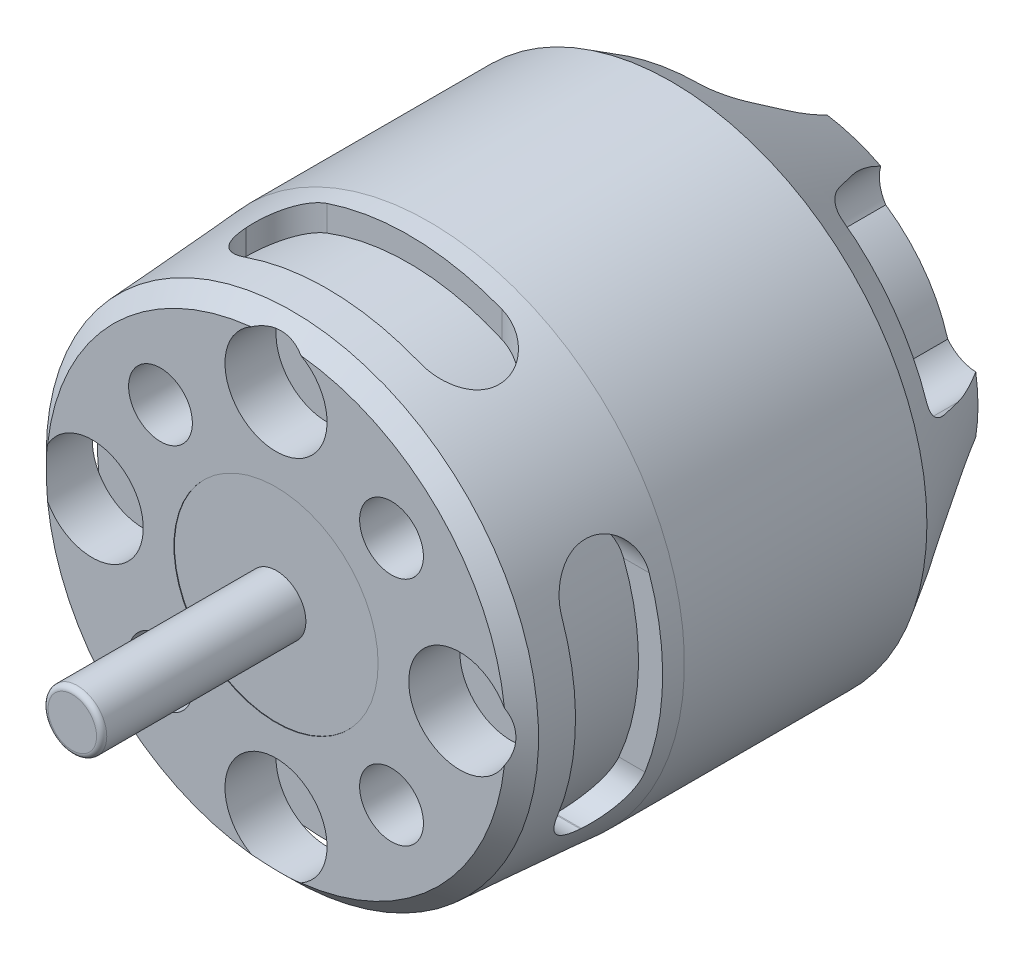
from build123d import *

# Parameters (mm, degrees)
SKETCH1_R           = 12.7
BOSS_EXTRUDE1_DEPTH = 12.065
SKETCH2_R           = 11.43
CUT_EXTRUDE1_DEPTH  = 12.065
CUT_EXTRUDE2_DEPTH  = 12.065
CUT_EXTRUDE3_DEPTH  = 35.553570476
CIRPATTERN1_COUNT   = 2
CIRPATTERN1_ANGLE   = 90
SKETCH9_R           = 1.5875
SKETCH9_R_2         = 2.54
CUT_EXTRUDE4_DEPTH  = 5.08
SKETCH9_3_R         = 5.08
CUT_EXTRUDE5_DEPTH  = 0.0254
SKETCH10_R          = 1.4605
BOSS_EXTRUDE2_DEPTH = 10.16
CHAMFER1_SIZE       = 0.818240846
CHAMFER1_SIZE_2     = 0.762
FILLET1_R           = 0.254
BOSS_EXTRUDE3_START = -26.67
SKETCH10_2_R        = 1.4605
BOSS_EXTRUDE3_DEPTH = 26.67
FILLET2_R           = 0.254
BOSS_EXTRUDE5_START = 15.24
SKETCH12_R          = 11.43
BOSS_EXTRUDE5_DEPTH = 15.24


with BuildPart() as part:
    # Sketch1 → Boss-Extrude1 (new body)
    with BuildSketch(Plane.XY):
        with Locations(Location((0, 0, 0), (0, 0, 180))):
            Circle(SKETCH1_R)
    extrude(amount=BOSS_EXTRUDE1_DEPTH)

    # Sketch2 → Cut-Extrude1 (cut)
    with BuildSketch(Plane(origin=(0, 0, 0), x_dir=(-1, 0, 0), z_dir=(0, 0, -1))):
        Circle(SKETCH2_R)
    extrude(amount=-CUT_EXTRUDE1_DEPTH, mode=Mode.SUBTRACT)

    # Sketch4 → Revolve2 (revolve)
    with BuildSketch(Plane(origin=(0, 0, 0), x_dir=(1, 0, 0), z_dir=(0, 1, 0))):
        Polygon((12.7, 0), (8.89, 6.35), (0, 6.35), (0, 0), align=None)
    revolve(axis=Axis((0, 0, 0), (0, 0, -1)))

    # Sketch5 → Cut-Extrude2 (cut)
    with BuildSketch(Plane(origin=(0, 0, -6.35), x_dir=(-1, 0, 0), z_dir=(0, 0, -1))):
        with BuildLine():
            Line((7.047210838, -7.304762618), (7.333700493, -8.186487115))
            ThreePointArc((7.333700493, -8.186487115), (7.338135843, -8.957467655), (6.895789186, -9.588942199))
            ThreePointArc((6.895789186, -9.588942199), (3.687495301, -11.220610474), (0.136739712, -11.810208434))
            ThreePointArc((0.136739712, -11.810208434), (-0.639426486, -11.583172221), (-1.121191937, -10.933648195))
            Line((-1.121191937, -10.933648195), (-1.407681592, -10.051923698))
            ThreePointArc((-1.407681592, -10.051923698), (-1.311811301, -8.635757129), (-0.263332325, -7.678986153))
            ThreePointArc((-0.263332325, -7.678986153), (2.374332076, -7.307442743), (4.726635139, -6.05764744))
            ThreePointArc((4.726635139, -6.05764744), (6.137248319, -6.215410941), (7.047210838, -7.304762618))
        make_face()
        with BuildLine():
            Line((9.12495, 4.445), (10.05205, 4.445))
            ThreePointArc((10.05205, 4.445), (10.818657769, 4.187527791), (11.274430585, 3.519507919))
            ThreePointArc((11.274430585, 3.519507919), (11.811, 0), (11.274430585, -3.519507919))
            ThreePointArc((11.274430585, -3.519507919), (10.818657769, -4.187527791), (10.05205, -4.445))
            Line((10.05205, -4.445), (9.12495, -4.445))
            ThreePointArc((9.12495, -4.445), (7.807721106, -3.916202398), (7.221775656, -2.623381144))
            ThreePointArc((7.221775656, -2.623381144), (7.6835, 0), (7.221775656, 2.623381144))
            ThreePointArc((7.221775656, 2.623381144), (7.807721106, 3.916202398), (9.12495, 4.445))
        make_face()
        with BuildLine():
            Line((-4.769534176, -8.959591578), (-5.519573832, -9.504527285))
            ThreePointArc((-5.519573832, -9.504527285), (-6.2514493, -9.746991643), (-6.988709915, -9.521431338))
            ThreePointArc((-6.988709915, -9.521431338), (-9.555299721, -6.942331615), (-11.215049451, -3.704374011))
            ThreePointArc((-11.215049451, -3.704374011), (-11.201743989, -2.933495532), (-10.744984725, -2.312366205))
            Line((-10.744984725, -2.312366205), (-9.994945069, -1.767430498))
            ThreePointArc((-9.994945069, -1.767430498), (-8.618465076, -1.420989027), (-7.384523983, -2.122493297))
            ThreePointArc((-7.384523983, -2.122493297), (-6.216082076, -4.516247986), (-4.300554487, -6.367213154))
            ThreePointArc((-4.300554487, -6.367213154), (-4.014693047, -7.757537613), (-4.769534176, -8.959591578))
        make_face()
        with BuildLine():
            Line((-9.994945069, 1.767430498), (-10.744984725, 2.312366205))
            ThreePointArc((-10.744984725, 2.312366205), (-11.201743989, 2.933495532), (-11.215049451, 3.704374011))
            ThreePointArc((-11.215049451, 3.704374011), (-9.555299721, 6.942331615), (-6.988709915, 9.521431338))
            ThreePointArc((-6.988709915, 9.521431338), (-6.2514493, 9.746991643), (-5.519573832, 9.504527285))
            Line((-5.519573832, 9.504527285), (-4.769534176, 8.959591578))
            ThreePointArc((-4.769534176, 8.959591578), (-4.014693047, 7.757537613), (-4.300554487, 6.367213154))
            ThreePointArc((-4.300554487, 6.367213154), (-6.216082076, 4.516247986), (-7.384523983, 2.122493297))
            ThreePointArc((-7.384523983, 2.122493297), (-8.618465076, 1.420989027), (-9.994945069, 1.767430498))
        make_face()
        with BuildLine():
            Line((-1.407681592, 10.051923698), (-1.121191937, 10.933648195))
            ThreePointArc((-1.121191937, 10.933648195), (-0.639426486, 11.583172221), (0.136739712, 11.810208434))
            ThreePointArc((0.136739712, 11.810208434), (3.649799721, 11.232928514), (6.831241593, 9.635032916))
            ThreePointArc((6.831241593, 9.635032916), (7.3257247, 8.995137717), (7.333700493, 8.186487115))
            Line((7.333700493, 8.186487115), (7.047210838, 7.304762618))
            ThreePointArc((7.047210838, 7.304762618), (6.137248319, 6.215410941), (4.726635139, 6.05764744))
            ThreePointArc((4.726635139, 6.05764744), (2.374332076, 7.307442743), (-0.263332325, 7.678986153))
            ThreePointArc((-0.263332325, 7.678986153), (-1.311811301, 8.635757129), (-1.407681592, 10.051923698))
        make_face()
    extrude(amount=-CUT_EXTRUDE2_DEPTH, mode=Mode.SUBTRACT)

    # Sketch6 → Revolve3 (revolve)
    with BuildSketch(Plane(origin=(0, 0, 0), x_dir=(1, 0, 0), z_dir=(0, 1, 0)), mode=Mode.PRIVATE) as revolve3_sk:
        Polygon((12.192, -19.685), (12.7, -12.065), (0, -12.065), (0, -19.685), align=None)
    revolve(revolve3_sk.sketch.rotate(Axis((0, 0, 12.065), (0, 0, 1)), 9.100389517), axis=Axis((0, 0, 12.065), (0, 0, 1)))

    # Sketch7 → Cut-Extrude3 (cut, through all)
    with BuildSketch(Plane(origin=(0, 12.7, 0), x_dir=(1, 0, 0), z_dir=(0, 1, 0))):
        with BuildLine():
            Line((4.629082018, -13.081), (-4.057717982, -13.081))
            ThreePointArc((-4.057717982, -13.081), (-5.476598449, -13.668719533), (-6.064317982, -15.0876))
            Line((-6.064317982, -15.0876), (-6.064317982, -15.1384))
            ThreePointArc((-6.064317982, -15.1384), (-5.476598449, -16.557280467), (-4.057717982, -17.145))
            Line((-4.057717982, -17.145), (4.629082018, -17.145))
            ThreePointArc((4.629082018, -17.145), (6.047962485, -16.557280467), (6.635682018, -15.1384))
            Line((6.635682018, -15.1384), (6.635682018, -15.0876))
            ThreePointArc((6.635682018, -15.0876), (6.047962485, -13.668719533), (4.629082018, -13.081))
        make_face()
    cut_extrude3 = extrude(amount=-CUT_EXTRUDE3_DEPTH, mode=Mode.SUBTRACT)

    # CirPattern1: Cut-Extrude3 ×2 about axis
    cirpattern1_axis = Axis((0, 0, 19.685), (0, 0, -1))
    for i in range(1, CIRPATTERN1_COUNT):
        add(cut_extrude3.rotate(cirpattern1_axis, i * CIRPATTERN1_ANGLE / (CIRPATTERN1_COUNT - 1)), mode=Mode.SUBTRACT)

    # Sketch9 → Cut-Extrude4 (cut)
    with BuildSketch(Plane.XY.offset(19.685)):
        with Locations((-5.747363917, -5.747363917)):
            Circle(SKETCH9_R)
        with Locations((-9.144, 0)):
            Circle(SKETCH9_R_2)
        with Locations((-5.747363917, 5.747363917)):
            Circle(SKETCH9_R)
        with Locations((0, 9.144)):
            Circle(SKETCH9_R_2)
        with Locations((5.747363917, 5.747363917)):
            Circle(SKETCH9_R)
        with Locations((9.144, 0)):
            Circle(SKETCH9_R_2)
        with Locations((5.747363917, -5.747363917)):
            Circle(SKETCH9_R)
        with Locations((0, -9.144)):
            Circle(SKETCH9_R_2)
    extrude(amount=-CUT_EXTRUDE4_DEPTH, mode=Mode.SUBTRACT)

    # Sketch9<3> → Cut-Extrude5 (cut)
    with BuildSketch(Plane.XY.offset(19.685)):
        Circle(SKETCH9_3_R)
    extrude(amount=-CUT_EXTRUDE5_DEPTH, mode=Mode.SUBTRACT)

    # Sketch10 → Boss-Extrude2 (add)
    with BuildSketch(Plane.XY.offset(19.6596)):
        Circle(SKETCH10_R)
    extrude(amount=BOSS_EXTRUDE2_DEPTH)

    # Chamfer1
    # the kernel refuses this chamfer: 0.818240846, 0.762 mm, written as the material it takes off along each edge
    with BuildSketch(Plane(origin=(0, 0, 19.685), x_dir=(0.9874127315135418, 0.15816478003957213, 0), z_dir=(0.15816478003957213, -0.9874127315135418, 0))) as chamfer1_piece_1:
        Polygon((12.192 + CHAMFER1_SIZE * 0.0665190105024, -CHAMFER1_SIZE * 0.997785157536), (12.192 - CHAMFER1_SIZE_2, 0), (12.192, 0), align=None)
    revolve(axis=Axis((0, 0, 19.685), (0, 0, 1)), mode=Mode.SUBTRACT)

    # Fillet1
    fillet1_edges = [part.edges().sort_by_distance(p)[0] for p in [
        (-1.4605, 0, 29.8196),
    ]]
    fillet(fillet1_edges, radius=FILLET1_R)

    # Sketch10<2> → Boss-Extrude3 (add)
    with BuildSketch(Plane.XY.offset(19.6596).offset(BOSS_EXTRUDE3_START)):
        Circle(SKETCH10_2_R)
    extrude(amount=BOSS_EXTRUDE3_DEPTH)

    # Fillet2
    fillet2_edges = [part.edges().sort_by_distance(p)[0] for p in [
        (-1.4605, 0, -7.0104),
    ]]
    fillet(fillet2_edges, radius=FILLET2_R)

    # Sketch12 → Boss-Extrude5 (add)
    with BuildSketch(Plane(origin=(0, 0, 17.145), x_dir=(-1, 0, 0), z_dir=(0, 0, -1)).offset(BOSS_EXTRUDE5_START)):
        Circle(SKETCH12_R)
    extrude(amount=-BOSS_EXTRUDE5_DEPTH)


solid = part.part
